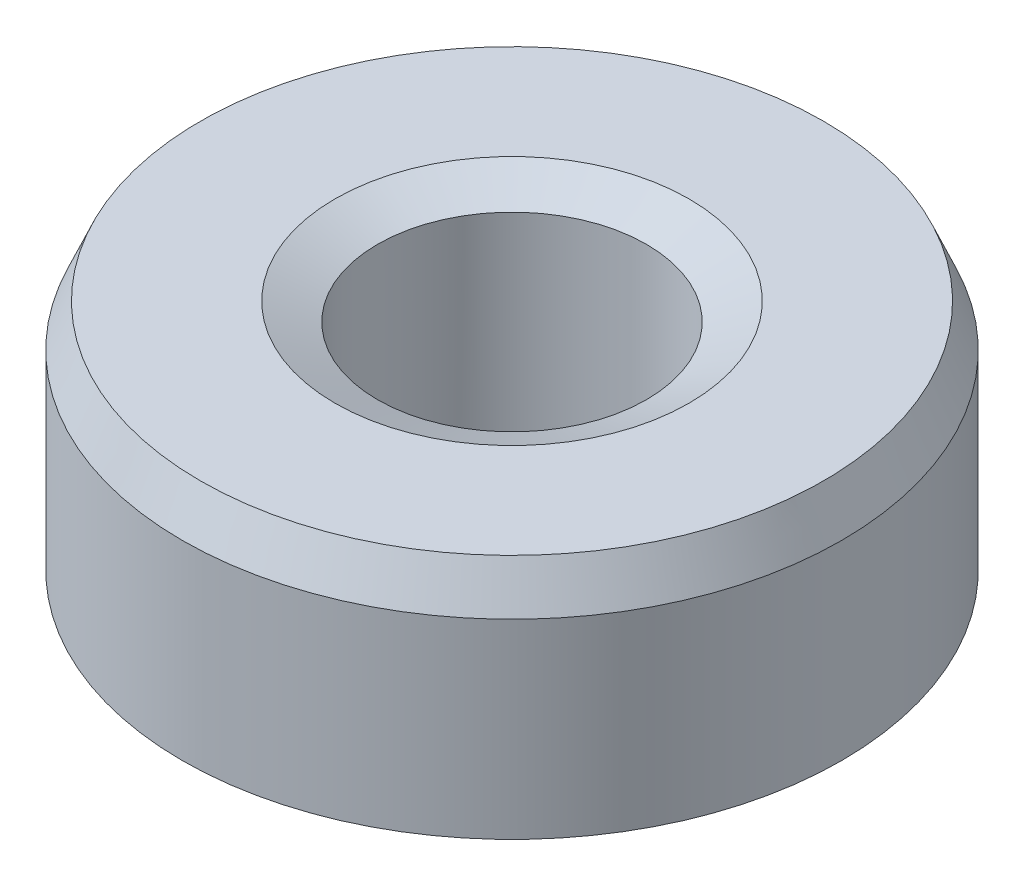
from build123d import *
from OCP.BRepFilletAPI import BRepFilletAPI_MakeChamfer

# Parameters (mm, degrees)
SKETCH1_R           = 7.5
BOSS_EXTRUDE1_DEPTH = 5.716596069
SKETCH2_R           = 3.060569153
CUT_EXTRUDE1_DEPTH  = 13.049044386
CHAMFER1_SIZE       = 0.966116341
CHAMFER1_SIZE2      = 0.412879435


with BuildPart() as part:
    # Sketch1 → Boss-Extrude1 (new body)
    with BuildSketch(Plane(origin=(0, 0, 0), x_dir=(1, 0, 0), z_dir=(0, 1, 0))):
        Circle(SKETCH1_R)
    extrude(amount=BOSS_EXTRUDE1_DEPTH)

    # Sketch2 → Cut-Extrude1 (cut, through all)
    with BuildSketch(Plane(origin=(0, 0, 0), x_dir=(1, 0, 0), z_dir=(0, 1, 0))):
        Circle(SKETCH2_R)
    extrude(amount=CUT_EXTRUDE1_DEPTH, mode=Mode.SUBTRACT)

    # Chamfer1: one chamfer whose edges measure the first distance from different faces: ONE call of the kernel's chamfer builder (chamfer() names one face for all edges)
    chamfer1_edges_1 = [part.edges().sort_by_distance(p)[0] for p in [
        (-3.060569153, 5.716596069, 0),
    ]]
    chamfer1_side_1 = [part.faces().sort_by_distance(p)[0] for p in [
        (-7.287867966, 5.716596069, 0),
    ]]
    chamfer1_edges_2 = [part.edges().sort_by_distance(p)[0] for p in [
        (-3.060569153, 0, 0),
    ]]
    chamfer1_side_2 = [part.faces().sort_by_distance(p)[0] for p in [
        (-3.060569153, 2.858298035, 0),
    ]]
    chamfer1_edges_3 = [part.edges().sort_by_distance(p)[0] for p in [
        (-7.5, 0, 0),
    ]]
    chamfer1_side_3 = [part.faces().sort_by_distance(p)[0] for p in [
        (-7.287867966, 0, 0),
    ]]
    chamfer1_edges_4 = [part.edges().sort_by_distance(p)[0] for p in [
        (-7.5, 5.716596069, 0),
    ]]
    chamfer1_side_4 = [part.faces().sort_by_distance(p)[0] for p in [
        (-7.5, 2.858298035, 0),
    ]]
    chamfer1 = BRepFilletAPI_MakeChamfer(part.part.solid().wrapped)
    for e in chamfer1_edges_1:
        chamfer1.Add(CHAMFER1_SIZE, CHAMFER1_SIZE2, e.wrapped, chamfer1_side_1[0].wrapped)  # the first distance lies on this face
    for e in chamfer1_edges_2:
        chamfer1.Add(CHAMFER1_SIZE, CHAMFER1_SIZE2, e.wrapped, chamfer1_side_2[0].wrapped)  # the first distance lies on this face
    for e in chamfer1_edges_3:
        chamfer1.Add(CHAMFER1_SIZE, CHAMFER1_SIZE2, e.wrapped, chamfer1_side_3[0].wrapped)  # the first distance lies on this face
    for e in chamfer1_edges_4:
        chamfer1.Add(CHAMFER1_SIZE, CHAMFER1_SIZE2, e.wrapped, chamfer1_side_4[0].wrapped)  # the first distance lies on this face
    add(Compound.cast(chamfer1.Shape()), mode=Mode.REPLACE)


solid = part.part
